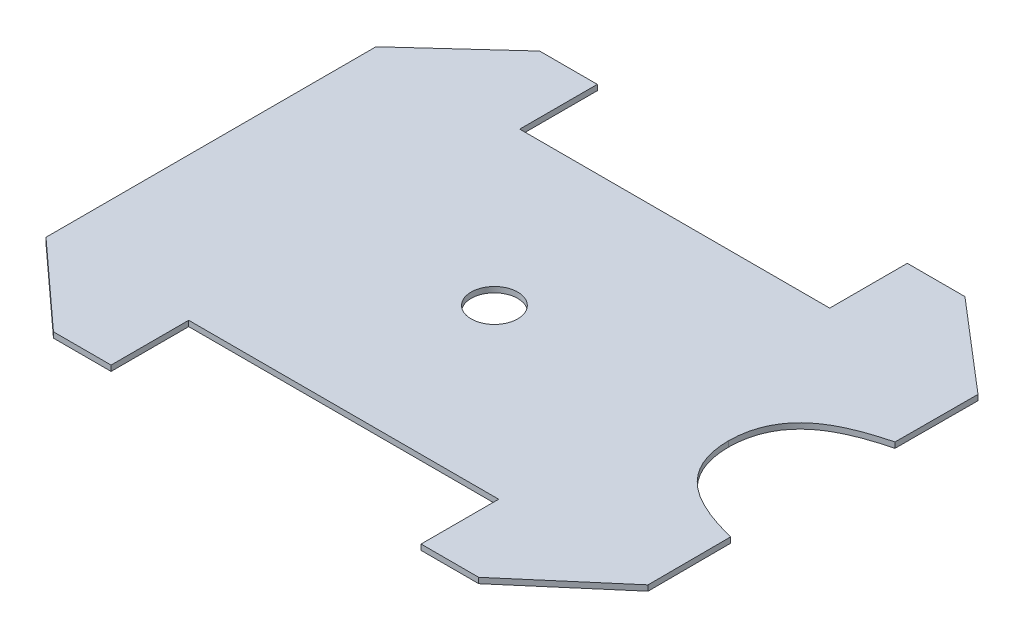
from build123d import *

# Parameters (mm, degrees)
EXTRUDE_1_DEPTH     = 5
SKETCH_2_R          = 21
CUT_EXTRUDE_1_DEPTH = 402.096820895


with BuildPart() as part:
    # Эскиз1 → Вытянуть1 (new body)
    with BuildSketch(Plane(origin=(0, 0, 0), x_dir=(1, 0, 0), z_dir=(0, 1, 0))):
        with BuildLine():
            Line((-269.7921816, 74.660680838), (-269.7921816, -223.012011978))
            Line((-269.7921816, -223.012011978), (-192.586469874, -293.492830448))
            Line((-192.586469874, -293.492830448), (-140.586469874, -293.492830448))
            Line((-140.586469874, -293.492830448), (-140.586469874, -223.492830448))
            Line((-140.586469874, -223.492830448), (139.068300868, -223.492830448))
            Line((139.068300868, -223.492830448), (139.068300868, -293.492830448))
            Line((139.068300868, -293.492830448), (191.068300868, -293.492830448))
            Line((191.068300868, -293.492830448), (273.341577689, -223.012011978))
            Line((273.341577689, -223.012011978), (273.101729514, -148.382005757))
            add(Edge.make_bspline(
                [(273.101729514, -148.382005757), (239.43664156, -139.498513163), (197.437007815, -124.724670791), (197.047353036, -74.17566557)],
                knots=[0, 0, 0, 0, 1, 1, 1, 1], degree=3))
            add(Edge.make_bspline(
                [(273.101729514, 0.030674617), (239.43664156, -8.852817977), (197.437007815, -23.62666035), (197.047353036, -74.17566557)],
                knots=[0, 0, 0, 0, 1, 1, 1, 1], degree=3))
            Line((273.101729514, 0.030674617), (273.341577689, 74.660680838))
            Line((273.341577689, 74.660680838), (191.068300868, 145.141499308))
            Line((191.068300868, 145.141499308), (139.068300868, 145.141499308))
            Line((139.068300868, 145.141499308), (139.068300868, 75.141499308))
            Line((139.068300868, 75.141499308), (-140.586469874, 75.141499308))
            Line((-140.586469874, 75.141499308), (-140.586469874, 145.141499308))
            Line((-140.586469874, 145.141499308), (-192.586469874, 145.141499308))
            Line((-192.586469874, 145.141499308), (-269.7921816, 74.660680838))
        make_face()
    extrude(amount=EXTRUDE_1_DEPTH)

    # Эскиз2 → Вырез-Вытянуть1 (cut, through all)
    with BuildSketch(Plane(origin=(0, 5, 0), x_dir=(-1, 0, 0), z_dir=(0, 1, 0))):
        with Locations((14.229950912, 74.026657254)):
            Circle(SKETCH_2_R)
    extrude(amount=-CUT_EXTRUDE_1_DEPTH, mode=Mode.SUBTRACT)


solid = part.part
